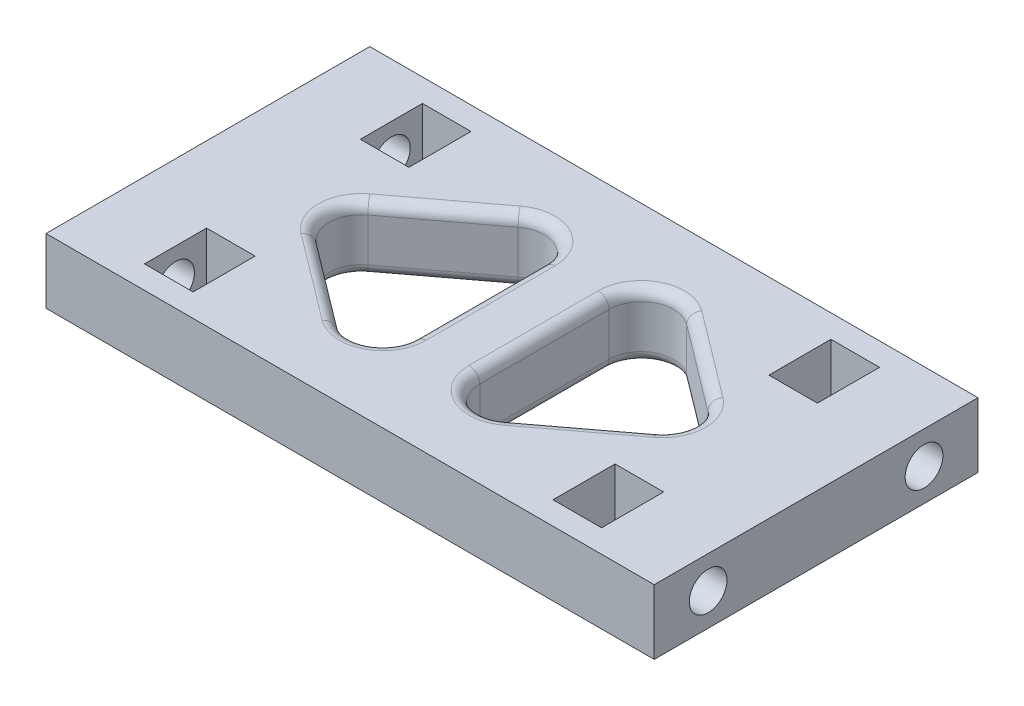
from build123d import *

# Parameters (mm, degrees)
SKETCH1_W           = 30
SKETCH1_H           = 6
BOSS_EXTRUDE1_DEPTH = 28.175
SKETCH2_R           = 1.75
CUT_EXTRUDE1_DEPTH  = 7
CUT_EXTRUDE2_DEPTH  = 4.5
CUT_EXTRUDE3_DEPTH  = 33.478156121
FILLET1_R           = 3
FILLET2_R           = 1
FILLET3_R           = 0.5


with BuildPart() as part:
    # Sketch1 → Boss-Extrude1 (new, symmetric)
    with BuildSketch(Plane(origin=(0, 0, 0), x_dir=(0, 0, -1), z_dir=(1, 0, 0))):
        Rectangle(SKETCH1_W, SKETCH1_H)
    extrude(amount=BOSS_EXTRUDE1_DEPTH, both=True)

    # Sketch2 → Cut-Extrude1 (cut)
    with BuildSketch(Plane(origin=(28.175, 0, 0), x_dir=(0, 0, -1), z_dir=(1, 0, 0))):
        with Locations((-10, 0)):
            Circle(SKETCH2_R)
        with Locations((10, 0)):
            Circle(SKETCH2_R)
    cut_extrude1 = extrude(amount=-CUT_EXTRUDE1_DEPTH, mode=Mode.SUBTRACT)

    # Sketch3 → Cut-Extrude2 (cut)
    with BuildSketch(Plane(origin=(21.175, 0, 0), x_dir=(0, 0, -1), z_dir=(1, 0, 0))):
        Polygon((-12.875, 3), (-12.875, -1.659882024), (-10, -3.319764048), (-7.125, -1.659882024), (-7.125, 3), align=None)
        Polygon((12.875, 3), (7.125, 3), (7.125, -1.659882024), (10, -3.319764048), (12.875, -1.659882024), align=None)
    cut_extrude2 = extrude(amount=-CUT_EXTRUDE2_DEPTH, mode=Mode.SUBTRACT)

    # Mirror1: Cut-Extrude1, Cut-Extrude2 across plane
    add(cut_extrude1.mirror(Plane(origin=(0, 0, 0), x_dir=(0, 0, 1), z_dir=(1, 0, 0))), mode=Mode.SUBTRACT)
    add(cut_extrude2.mirror(Plane(origin=(0, 0, 0), x_dir=(0, 0, 1), z_dir=(1, 0, 0))), mode=Mode.SUBTRACT)

    # Sketch4 → Cut-Extrude3 (cut, through all)
    with BuildSketch(Plane(origin=(0, 3, 0), x_dir=(1, 0, 0), z_dir=(0, 1, 0))):
        Polygon((-3, -12), (-3, 12), (-18.925, 0), align=None)
        Polygon((18.925, 0), (3, 12), (3, -12), align=None)
    extrude(amount=-CUT_EXTRUDE3_DEPTH, mode=Mode.SUBTRACT)

    # Fillet1
    fillet1_edges = [part.edges().sort_by_distance(p)[0] for p in [
        (18.925, 0, 0),
        (3, 0, 12),
        (3, 0, -12),
        (-3, 0, 12),
        (-18.925, 0, 0),
        (-3, 0, -12),
    ]]
    fillet(fillet1_edges, radius=FILLET1_R)

    # Fillet2
    fillet2_edges = [part.edges().sort_by_distance(p)[0] for p in [
        (16.939987306, 3, 0),
        (11.775405304, 3, 5.387449692),
        (4.661387837, 3, 8.66782971),
        (3, 3, 0),
        (4.661387837, 3, -8.66782971),
        (16.939987306, -3, 0),
        (11.775405304, -3, 5.387449692),
        (4.661387837, -3, 8.66782971),
        (3, -3, 0),
        (4.661387837, -3, -8.66782971),
        (-16.939987306, -3, 0),
        (-11.775405304, -3, 5.387449692),
        (-4.661387837, -3, 8.66782971),
        (-3, -3, 0),
        (-4.661387837, -3, -8.66782971),
        (-16.939987306, 3, 0),
        (-11.775405304, 3, 5.387449692),
        (-4.661387837, 3, 8.66782971),
        (-3, 3, 0),
        (-4.661387837, 3, -8.66782971),
        (11.775405304, 3, -5.387449692),
        (11.775405304, -3, -5.387449692),
        (-11.775405304, -3, -5.387449692),
        (-11.775405304, 3, -5.387449692),
    ]]
    fillet(fillet2_edges, radius=FILLET2_R)

    # Fillet3
    fillet3_edges = [part.edges().sort_by_distance(p)[0] for p in [
        (-18.925, -3, -10.553847577),
        (-18.925, -3, -9.446152423),
        (-18.925, -3, 9.446152423),
        (-18.925, -3, 10.553847577),
        (18.925, -3, -9.446152423),
        (18.925, -3, -10.553847577),
        (18.925, -3, 10.553847577),
        (18.925, -3, 9.446152423),
    ]]
    fillet(fillet3_edges, radius=FILLET3_R)


solid = part.part
